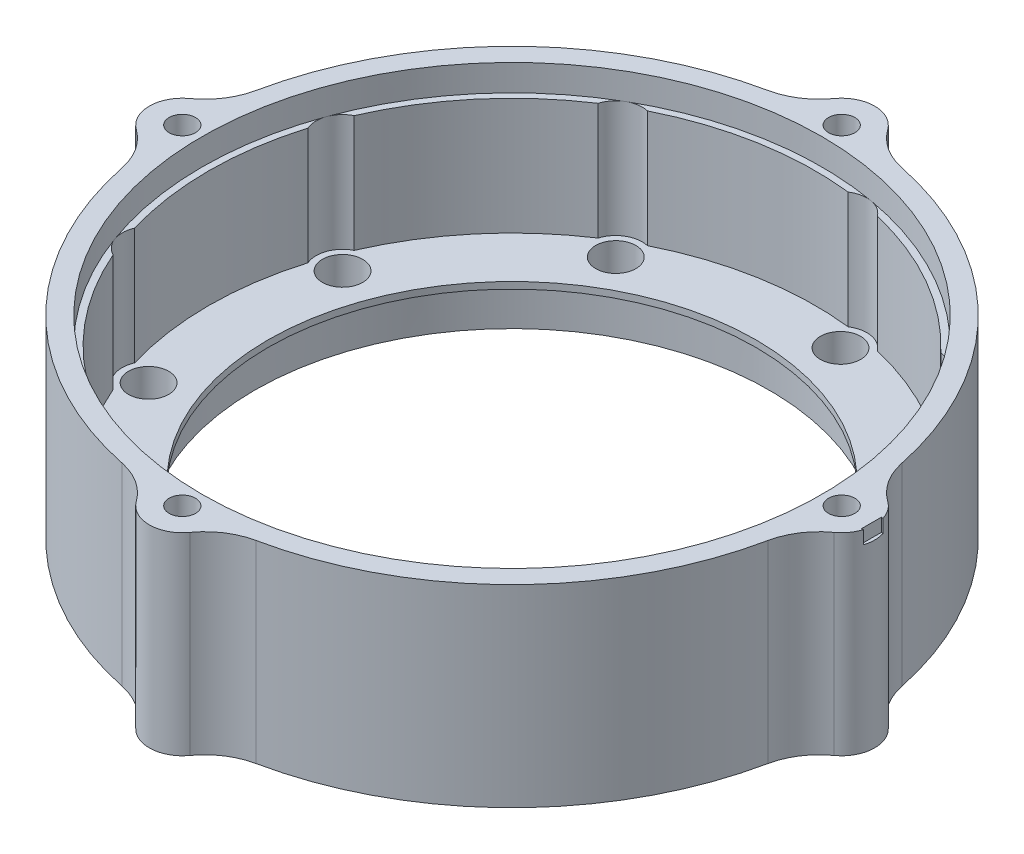
from build123d import *
from build123d.topology import SkipClean

# Parameters (mm, degrees)
SKETCH1_R            = 50
BOSS_EXTRUDE1_DEPTH  = 5
SKETCH2_R            = 3
BOSS_EXTRUDE2_DEPTH  = 30
SKETCH3_R            = 50
BOSS_EXTRUDE3_DEPTH  = 28
SKETCH4_R            = 39
CUT_EXTRUDE1_DEPTH   = 6
SKETCH5_R            = 3
CUT_EXTRUDE2_DEPTH   = 44
SKETCH6_R            = 50
SKETCH6_R_2          = 39
BOSS_EXTRUDE4_DEPTH  = 3
CUT_EXTRUDE3_START   = -4
SKETCH7_R            = 47
SKETCH7_R_2          = 46
CUT_EXTRUDE3_DEPTH   = 4
BOSS_EXTRUDE5_START  = -1
SKETCH8_R            = 39
SKETCH8_R_2          = 37
BOSS_EXTRUDE5_DEPTH  = 1
SKETCH9_R            = 5
SKETCH9_R_2          = 2
BOSS_EXTRUDE6_DEPTH  = 33
SKETCH10_R           = 3.05
CUT_EXTRUDE6_DEPTH   = 2.5
SKETCH11_R           = 47.15
CUT_EXTRUDE7_DEPTH   = 4
SKETCH12_R           = 39
SKETCH12_R_2         = 3.05
BOSS_EXTRUDE7_DEPTH  = 6.3
SKETCH13_R           = 39
SKETCH13_R_2         = 37
BOSS_EXTRUDE8_DEPTH  = 1
SKETCH14_W           = 114
SKETCH14_H           = 3
CUT_EXTRUDE8_DEPTH   = 59.5
SKETCH15_R           = 39
SKETCH15_R_2         = 2
BOSS_EXTRUDE9_DEPTH  = 1
SKETCH16_R           = 3.05
BOSS_EXTRUDE10_DEPTH = 0.7
SKETCH17_W           = 114.080184059
SKETCH17_H           = 0.7
CUT_EXTRUDE9_DEPTH   = 69.85
CUT_EXTRUDE10_START  = -8
CUT_EXTRUDE10_DEPTH  = 8
CUT_EXTRUDE12_START  = -21.3
SKETCH20_R           = 57
SKETCH20_R_2         = 50
CUT_EXTRUDE12_DEPTH  = 21.3
BOSS_EXTRUDE11_START = -21.3
BOSS_EXTRUDE11_DEPTH = 21.3
CUT_EXTRUDE13_START  = -21.3
CUT_EXTRUDE13_DEPTH  = 21.3
FILLET1_R            = 10
SKETCH23_R           = 2
BOSS_EXTRUDE12_DEPTH = 8
CUT_EXTRUDE14_START  = -4
SKETCH24_R           = 47
SKETCH24_R_2         = 46
CUT_EXTRUDE14_DEPTH  = 4
SKETCH25_W           = 1
SKETCH25_H           = 3
CUT_EXTRUDE15_DEPTH  = 2


# Read off the part's stored shape, not the designer's step: Cut-Extrude13
with BuildPart() as part:
    # Sketch1 → Boss-Extrude1 (new body)
    with BuildSketch(Plane(origin=(0, 0, 0), x_dir=(1, 0, 0), z_dir=(0, 1, 0))):
        with Locations(Location((0, 0, 0), (0, 0, 270))):
            Circle(SKETCH1_R)
    extrude(amount=BOSS_EXTRUDE1_DEPTH)

    # Sketch2 → Boss-Extrude2 (add)
    with BuildSketch(Plane(origin=(0, 5, 0), x_dir=(1, 0, 0), z_dir=(0, 1, 0))):
        with Locations(Location((43, 0, 0), (0, 0, 270))):
            Circle(SKETCH2_R)
        with Locations(Location((32.939911054, -27.639867217, 0), (0, 0, 270))):
            Circle(SKETCH2_R)
        with Locations(Location((7.46687164, -42.34673338, 0), (0, 0, 270))):
            Circle(SKETCH2_R)
        with Locations(Location((-21.5, -37.239092363, 0), (0, 0, 270))):
            Circle(SKETCH2_R)
        with Locations(Location((-40.406782694, -14.706866163, 0), (0, 0, 270))):
            Circle(SKETCH2_R)
        with Locations(Location((-40.406782694, 14.706866163, 0), (0, 0, 270))):
            Circle(SKETCH2_R)
        with Locations(Location((-21.5, 37.239092363, 0), (0, 0, 270))):
            Circle(SKETCH2_R)
        with Locations(Location((7.46687164, 42.34673338, 0), (0, 0, 270))):
            Circle(SKETCH2_R)
        with Locations(Location((32.939911054, 27.639867217, 0), (0, 0, 270))):
            Circle(SKETCH2_R)
    extrude(amount=BOSS_EXTRUDE2_DEPTH)

    # Sketch3 → Boss-Extrude3 (add)
    with BuildSketch(Plane(origin=(0, 5, 0), x_dir=(1, 0, 0), z_dir=(0, 1, 0))):
        with Locations(Location((0, 0, 0), (0, 0, 270))):
            Circle(SKETCH3_R)
        with BuildLine():
            ThreePointArc((45.918604651, 2.735278211), (43.225860556, 15.732926593), (36.933894872, 27.42056545))
            ThreePointArc((36.933894872, 27.42056545), (36.004088827, 30.211017655), (33.417488986, 31.611254798))
            ThreePointArc((33.417488986, 31.611254798), (23, 39.837168574), (10.667405207, 44.746021791))
            ThreePointArc((10.667405207, 44.746021791), (8.16146435, 46.285964392), (5.27995883, 45.695973945))
            ThreePointArc((5.27995883, 45.695973945), (-7.987816173, 45.301156639), (-20.590481909, 41.13431724))
            ThreePointArc((-20.590481909, 41.13431724), (-23.5, 40.703193978), (-25.328122743, 38.399039029))
            ThreePointArc((-25.328122743, 38.399039029), (-35.238044383, 29.568230046), (-42.213853702, 18.275408495))
            ThreePointArc((-42.213853702, 18.275408495), (-44.165553177, 16.074946736), (-44.084894193, 13.134766994))
            ThreePointArc((-44.084894193, 13.134766994), (-46, 0), (-44.084894193, -13.134766994))
            ThreePointArc((-44.084894193, -13.134766994), (-44.165553177, -16.074946736), (-42.213853702, -18.275408495))
            ThreePointArc((-42.213853702, -18.275408495), (-35.238044383, -29.568230046), (-25.328122743, -38.399039029))
            ThreePointArc((-25.328122743, -38.399039029), (-23.5, -40.703193978), (-20.590481909, -41.13431724))
            ThreePointArc((-20.590481909, -41.13431724), (-7.987816173, -45.301156639), (5.27995883, -45.695973945))
            ThreePointArc((5.27995883, -45.695973945), (8.16146435, -46.285964392), (10.667405207, -44.746021791))
            ThreePointArc((10.667405207, -44.746021791), (23, -39.837168574), (33.417488986, -31.611254798))
            ThreePointArc((33.417488986, -31.611254798), (36.004088827, -30.211017655), (36.933894872, -27.42056545))
            ThreePointArc((36.933894872, -27.42056545), (43.225860556, -15.732926593), (45.918604651, -2.735278211))
            ThreePointArc((45.918604651, -2.735278211), (47, 0), (45.918604651, 2.735278211))
        make_face(mode=Mode.SUBTRACT)
    extrude(amount=BOSS_EXTRUDE3_DEPTH)

    # Sketch4 → Cut-Extrude1 (cut)
    with BuildSketch(Plane(origin=(0, 5, 0), x_dir=(1, 0, 0), z_dir=(0, 1, 0))):
        with Locations(Location((0, 0, 0), (0, 0, 270))):
            Circle(SKETCH4_R)
    extrude(amount=-CUT_EXTRUDE1_DEPTH, mode=Mode.SUBTRACT)

    # Sketch5 → Cut-Extrude2 (cut, symmetric)
    with BuildSketch(Plane(origin=(0, 5, 0), x_dir=(1, 0, 0), z_dir=(0, 1, 0))):
        with Locations(Location((43, 0, 0), (0, 0, 270))):
            Circle(SKETCH5_R)
        with Locations(Location((32.939911054, -27.639867217, 0), (0, 0, 270))):
            Circle(SKETCH5_R)
        with Locations(Location((7.46687164, -42.34673338, 0), (0, 0, 270))):
            Circle(SKETCH5_R)
        with Locations(Location((-21.5, -37.239092363, 0), (0, 0, 270))):
            Circle(SKETCH5_R)
        with Locations(Location((-40.406782694, -14.706866163, 0), (0, 0, 270))):
            Circle(SKETCH5_R)
        with Locations(Location((-40.406782694, 14.706866163, 0), (0, 0, 270))):
            Circle(SKETCH5_R)
        with Locations(Location((-21.5, 37.239092363, 0), (0, 0, 270))):
            Circle(SKETCH5_R)
        with Locations(Location((7.46687164, 42.34673338, 0), (0, 0, 270))):
            Circle(SKETCH5_R)
        with Locations(Location((32.939911054, 27.639867217, 0), (0, 0, 270))):
            Circle(SKETCH5_R)
    extrude(amount=CUT_EXTRUDE2_DEPTH, both=True, mode=Mode.SUBTRACT)

    # Sketch6 → Boss-Extrude4 (add)
    with BuildSketch(Plane.XZ):
        with Locations(Location((0, 0, 0), (0, 0, 90))):
            Circle(SKETCH6_R)
        with Locations(Location((0, 0, 0), (0, 0, 90))):
            Circle(SKETCH6_R_2, mode=Mode.SUBTRACT)
    extrude(amount=-BOSS_EXTRUDE4_DEPTH)

    # Sketch7 → Cut-Extrude3 (cut)
    with BuildSketch(Plane(origin=(0, 33, 0), x_dir=(1, 0, 0), z_dir=(0, 1, 0)).offset(CUT_EXTRUDE3_START)):
        with Locations(Location((0, 0, 0), (0, 0, 270))):
            Circle(SKETCH7_R)
        Circle(SKETCH7_R_2, mode=Mode.SUBTRACT)
    extrude(amount=CUT_EXTRUDE3_DEPTH, mode=Mode.SUBTRACT)

    # Sketch8 → Boss-Extrude5 (add)
    with BuildSketch(Plane.XZ.offset(BOSS_EXTRUDE5_START)):
        with Locations(Location((0, 0, 0), (0, 0, 90))):
            Circle(SKETCH8_R)
        with Locations(Location((0, 0, 0), (0, 0, 270))):
            Circle(SKETCH8_R_2, mode=Mode.SUBTRACT)
    extrude(amount=BOSS_EXTRUDE5_DEPTH)

    # Sketch9 → Boss-Extrude6 (add)
    # profile 1 of 4: a face of its own
    with BuildSketch(Plane(origin=(0, 33, 0), x_dir=(1, 0, 0), z_dir=(0, 1, 0))):
        with Locations((52, 0)):
            Circle(SKETCH9_R)
        with Locations(Location((52, 0, 0), (0, 0, 270))):
            Circle(SKETCH9_R_2, mode=Mode.SUBTRACT)
    # profile 2 of 4: a face of its own
    with BuildSketch(Plane(origin=(0, 33, 0), x_dir=(1, 0, 0), z_dir=(0, 1, 0))):
        with Locations((-52, 0)):
            Circle(SKETCH9_R)
        with Locations(Location((-52, 0, 0), (0, 0, 270))):
            Circle(SKETCH9_R_2, mode=Mode.SUBTRACT)
    # profile 3 of 4: a face of its own
    with BuildSketch(Plane(origin=(0, 33, 0), x_dir=(1, 0, 0), z_dir=(0, 1, 0))):
        with Locations((0, 52)):
            Circle(SKETCH9_R)
        with Locations(Location((0, 52, 0), (0, 0, 270))):
            Circle(SKETCH9_R_2, mode=Mode.SUBTRACT)
    # profile 4 of 4: a face of its own
    with BuildSketch(Plane(origin=(0, 33, 0), x_dir=(1, 0, 0), z_dir=(0, 1, 0))):
        with Locations((0, -52)):
            Circle(SKETCH9_R)
        with Locations(Location((0, -52, 0), (0, 0, 270))):
            Circle(SKETCH9_R_2, mode=Mode.SUBTRACT)
    extrude(amount=-BOSS_EXTRUDE6_DEPTH)

    # Sketch10 → Cut-Extrude6 (cut)
    with BuildSketch(Plane(origin=(0, 5, 0), x_dir=(1, 0, 0), z_dir=(0, 1, 0))):
        with Locations(Location((32.939911054, -27.639867217, 0), (0, 0, 270))):
            Circle(SKETCH10_R)
        with Locations(Location((43, 0, 0), (0, 0, 270))):
            Circle(SKETCH10_R)
        with Locations(Location((7.46687164, -42.34673338, 0), (0, 0, 270))):
            Circle(SKETCH10_R)
        with Locations(Location((-21.5, -37.239092363, 0), (0, 0, 270))):
            Circle(SKETCH10_R)
        with Locations(Location((-40.406782694, -14.706866163, 0), (0, 0, 270))):
            Circle(SKETCH10_R)
        with Locations(Location((-40.406782694, 14.706866163, 0), (0, 0, 270))):
            Circle(SKETCH10_R)
        with Locations(Location((-21.5, 37.239092363, 0), (0, 0, 270))):
            Circle(SKETCH10_R)
        with Locations(Location((7.46687164, 42.34673338, 0), (0, 0, 270))):
            Circle(SKETCH10_R)
        with Locations(Location((32.939911054, 27.639867217, 0), (0, 0, 270))):
            Circle(SKETCH10_R)
    extrude(amount=-CUT_EXTRUDE6_DEPTH, mode=Mode.SUBTRACT)

    # Sketch11 → Cut-Extrude7 (cut)
    with BuildSketch(Plane(origin=(0, 33, 0), x_dir=(1, 0, 0), z_dir=(0, 1, 0))):
        with Locations(Location((0, 0, 0), (0, 0, 270))):
            Circle(SKETCH11_R)
    extrude(amount=-CUT_EXTRUDE7_DEPTH, mode=Mode.SUBTRACT)

    # Sketch12 → Boss-Extrude7 (add)
    with BuildSketch(Plane(origin=(0, 5, 0), x_dir=(1, 0, 0), z_dir=(0, 1, 0))):
        with BuildLine():
            ThreePointArc((36.933894872, -27.42056545), (43.225860556, -15.732926593), (45.918604651, -2.735278211))
            ThreePointArc((45.918604651, -2.735278211), (47, 0), (45.918604651, 2.735278211))
            ThreePointArc((45.918604651, 2.735278211), (43.225860556, 15.732926593), (36.933894872, 27.42056545))
            ThreePointArc((36.933894872, 27.42056545), (36.004088827, 30.211017655), (33.417488986, 31.611254798))
            ThreePointArc((33.417488986, 31.611254798), (23, 39.837168574), (10.667405207, 44.746021791))
            ThreePointArc((10.667405207, 44.746021791), (8.16146435, 46.285964392), (5.27995883, 45.695973945))
            ThreePointArc((5.27995883, 45.695973945), (-7.987816173, 45.301156639), (-20.590481909, 41.13431724))
            ThreePointArc((-20.590481909, 41.13431724), (-23.5, 40.703193978), (-25.328122743, 38.399039029))
            ThreePointArc((-25.328122743, 38.399039029), (-35.238044383, 29.568230046), (-42.213853702, 18.275408495))
            ThreePointArc((-42.213853702, 18.275408495), (-44.165553177, 16.074946736), (-44.084894193, 13.134766994))
            ThreePointArc((-44.084894193, 13.134766994), (-46, 0), (-44.084894193, -13.134766994))
            ThreePointArc((-44.084894193, -13.134766994), (-44.165553177, -16.074946736), (-42.213853702, -18.275408495))
            ThreePointArc((-42.213853702, -18.275408495), (-35.238044383, -29.568230046), (-25.328122743, -38.399039029))
            ThreePointArc((-25.328122743, -38.399039029), (-23.5, -40.703193978), (-20.590481909, -41.13431724))
            ThreePointArc((-20.590481909, -41.13431724), (-7.987816173, -45.301156639), (5.27995883, -45.695973945))
            ThreePointArc((5.27995883, -45.695973945), (8.16146435, -46.285964392), (10.667405207, -44.746021791))
            ThreePointArc((10.667405207, -44.746021791), (23, -39.837168574), (33.417488986, -31.611254798))
            ThreePointArc((33.417488986, -31.611254798), (36.004088827, -30.211017655), (36.933894872, -27.42056545))
        make_face()
        with Locations(Location((0, 0, 0), (0, 0, 270))):
            Circle(SKETCH12_R, mode=Mode.SUBTRACT)
        with Locations(Location((32.939911054, -27.639867217, 0), (0, 0, 270))):
            Circle(SKETCH12_R_2, mode=Mode.SUBTRACT)
        with Locations(Location((43, 0, 0), (0, 0, 270))):
            Circle(SKETCH12_R_2, mode=Mode.SUBTRACT)
        with Locations(Location((7.46687164, -42.34673338, 0), (0, 0, 270))):
            Circle(SKETCH12_R_2, mode=Mode.SUBTRACT)
        with Locations(Location((-21.5, -37.239092363, 0), (0, 0, 270))):
            Circle(SKETCH12_R_2, mode=Mode.SUBTRACT)
        with Locations(Location((-40.406782694, -14.706866163, 0), (0, 0, 270))):
            Circle(SKETCH12_R_2, mode=Mode.SUBTRACT)
        with Locations(Location((-40.406782694, 14.706866163, 0), (0, 0, 270))):
            Circle(SKETCH12_R_2, mode=Mode.SUBTRACT)
        with Locations(Location((-21.5, 37.239092363, 0), (0, 0, 270))):
            Circle(SKETCH12_R_2, mode=Mode.SUBTRACT)
        with Locations(Location((7.46687164, 42.34673338, 0), (0, 0, 270))):
            Circle(SKETCH12_R_2, mode=Mode.SUBTRACT)
        with Locations(Location((32.939911054, 27.639867217, 0), (0, 0, 270))):
            Circle(SKETCH12_R_2, mode=Mode.SUBTRACT)
    extrude(amount=BOSS_EXTRUDE7_DEPTH)

    # Sketch13 → Boss-Extrude8 (add)
    with BuildSketch(Plane(origin=(0, 11.3, 0), x_dir=(1, 0, 0), z_dir=(0, 1, 0))):
        with Locations(Location((0, 0, 0), (0, 0, 270))):
            Circle(SKETCH13_R)
        with Locations(Location((0, 0, 0), (0, 0, 90))):
            Circle(SKETCH13_R_2, mode=Mode.SUBTRACT)
    extrude(amount=-BOSS_EXTRUDE8_DEPTH)

    # Sketch14 → Cut-Extrude8 (cut, symmetric)
    with BuildSketch(Plane.XY):
        with Locations((0, 1.5)):
            Rectangle(SKETCH14_W, SKETCH14_H)
    extrude(amount=CUT_EXTRUDE8_DEPTH, both=True, mode=Mode.SUBTRACT)

    # Sketch15 → Boss-Extrude9 (add)
    with BuildSketch(Plane.XZ.offset(-3)):
        with BuildLine():
            ThreePointArc((4.489046086, -49.798076923), (35.355339059, -35.355339059), (49.798076923, -4.489046086))
            ThreePointArc((49.798076923, -4.489046086), (57, 0), (49.798076923, 4.489046086))
            ThreePointArc((49.798076923, 4.489046086), (35.355339059, 35.355339059), (4.489046086, 49.798076923))
            ThreePointArc((4.489046086, 49.798076923), (0, 57), (-4.489046086, 49.798076923))
            ThreePointArc((-4.489046086, 49.798076923), (-35.355339059, 35.355339059), (-49.798076923, 4.489046086))
            ThreePointArc((-49.798076923, 4.489046086), (-57, 0), (-49.798076923, -4.489046086))
            ThreePointArc((-49.798076923, -4.489046086), (-35.355339059, -35.355339059), (-4.489046086, -49.798076923))
            ThreePointArc((-4.489046086, -49.798076923), (0, -57), (4.489046086, -49.798076923))
        make_face()
        with Locations(Location((0, 0, 0), (0, 0, 90))):
            Circle(SKETCH15_R, mode=Mode.SUBTRACT)
        with Locations(Location((0, -52, 0), (0, 0, 90))):
            Circle(SKETCH15_R_2, mode=Mode.SUBTRACT)
        with Locations(Location((52, 0, 0), (0, 0, 90))):
            Circle(SKETCH15_R_2, mode=Mode.SUBTRACT)
        with Locations(Location((-52, 0, 0), (0, 0, 180))):
            Circle(SKETCH15_R_2, mode=Mode.SUBTRACT)
        with Locations(Location((0, 52, 0), (0, 0, 180))):
            Circle(SKETCH15_R_2, mode=Mode.SUBTRACT)
    extrude(amount=-BOSS_EXTRUDE9_DEPTH)

    # Sketch16 → Boss-Extrude10 (add)
    with BuildSketch(Plane(origin=(0, 4, 0), x_dir=(1, 0, 0), z_dir=(0, 1, 0))):
        with Locations(Location((32.939911054, -27.639867217, 0), (0, 0, 270))):
            Circle(SKETCH16_R)
        with Locations(Location((43, 0, 0), (0, 0, 270))):
            Circle(SKETCH16_R)
        with Locations(Location((7.46687164, -42.34673338, 0), (0, 0, 270))):
            Circle(SKETCH16_R)
        with Locations(Location((-21.5, -37.239092363, 0), (0, 0, 270))):
            Circle(SKETCH16_R)
        with Locations(Location((-40.406782694, -14.706866163, 0), (0, 0, 270))):
            Circle(SKETCH16_R)
        with Locations(Location((-40.406782694, 14.706866163, 0), (0, 0, 270))):
            Circle(SKETCH16_R)
        with Locations(Location((-21.5, 37.239092363, 0), (0, 0, 270))):
            Circle(SKETCH16_R)
        with Locations(Location((7.46687164, 42.34673338, 0), (0, 0, 270))):
            Circle(SKETCH16_R)
        with Locations(Location((32.939911054, 27.639867217, 0), (0, 0, 270))):
            Circle(SKETCH16_R)
    extrude(amount=BOSS_EXTRUDE10_DEPTH)

    # Sketch17 → Cut-Extrude9 (cut, symmetric)
    with BuildSketch(Plane.XY):
        with Locations((-0.04009203, 3.35)):
            Rectangle(SKETCH17_W, SKETCH17_H)
    extrude(amount=CUT_EXTRUDE9_DEPTH, both=True, mode=Mode.SUBTRACT)

    # Sketch18 → Cut-Extrude10 (cut)
    with BuildSketch(Plane(origin=(0, 33, 0), x_dir=(1, 0, 0), z_dir=(0, 1, 0)).offset(CUT_EXTRUDE10_START)):
        with BuildLine():
            ThreePointArc((4.489046086, -49.798076923), (35.355339059, -35.355339059), (49.798076923, -4.489046086))
            ThreePointArc((49.798076923, -4.489046086), (57, 0), (49.798076923, 4.489046086))
            ThreePointArc((49.798076923, 4.489046086), (35.355339059, 35.355339059), (4.489046086, 49.798076923))
            ThreePointArc((4.489046086, 49.798076923), (0, 57), (-4.489046086, 49.798076923))
            ThreePointArc((-4.489046086, 49.798076923), (-35.355339059, 35.355339059), (-49.798076923, 4.489046086))
            ThreePointArc((-49.798076923, 4.489046086), (-57, 0), (-49.798076923, -4.489046086))
            ThreePointArc((-49.798076923, -4.489046086), (-35.355339059, -35.355339059), (-4.489046086, -49.798076923))
            ThreePointArc((-4.489046086, -49.798076923), (0, -57), (4.489046086, -49.798076923))
        make_face()
    extrude(amount=CUT_EXTRUDE10_DEPTH, mode=Mode.SUBTRACT)

    # Sketch20 → Cut-Extrude12 (cut)
    with BuildSketch(Plane(origin=(0, 25, 0), x_dir=(1, 0, 0), z_dir=(0, 1, 0)).offset(CUT_EXTRUDE12_START)):
        Circle(SKETCH20_R)
        with Locations(Location((0, 0, 0), (0, 0, 180))):
            Circle(SKETCH20_R_2, mode=Mode.SUBTRACT)
    extrude(amount=CUT_EXTRUDE12_DEPTH, mode=Mode.SUBTRACT)

    # Sketch21 → Boss-Extrude11 (add)
    with BuildSketch(Plane(origin=(0, 25, 0), x_dir=(1, 0, 0), z_dir=(0, 1, 0)).offset(BOSS_EXTRUDE11_START)):
        with BuildLine():
            ThreePointArc((49.96, 1.99959996), (51.4, 1.428285686), (52, 0))
            ThreePointArc((52, 0), (51.4, -1.428285686), (49.96, -1.99959996))
            ThreePointArc((49.96, -1.99959996), (49.877472397, -3.498249168), (49.75, -4.993746089))
            ThreePointArc((49.75, -4.993746089), (55, 0), (49.75, 4.993746089))
            ThreePointArc((49.75, 4.993746089), (49.877472397, 3.498249168), (49.96, 1.99959996))
        make_face()
        with BuildLine():
            ThreePointArc((-4.992800781, -49.750094878), (0.001100002, -54.998999999), (4.994790821, -49.749895122))
            ThreePointArc((4.994790821, -49.749895122), (3.499281509, -49.877399982), (2.000618918, -49.959959207))
            ThreePointArc((2.000618918, -49.959959207), (2.000904727, -49.979478673), (2.001, -49.999))
            ThreePointArc((2.001, -49.999), (-0.018481328, -51.998905117), (-1.998620478, -49.960039193))
            ThreePointArc((-1.998620478, -49.960039193), (-3.497286371, -49.877539916), (-4.992800781, -49.750094878))
        make_face()
        with BuildLine():
            ThreePointArc((-49.95999844, 1.999638938), (-49.877467544, 3.498318366), (-49.74999004, 4.993845318))
            ThreePointArc((-49.74999004, 4.993845318), (-54.998, 0), (-49.74999004, -4.993845318))
            ThreePointArc((-49.74999004, -4.993845318), (-49.877467544, -3.498318366), (-49.95999844, -1.999638938))
            ThreePointArc((-49.95999844, -1.999638938), (-51.998, 0), (-49.95999844, 1.999638938))
        make_face()
        with BuildLine():
            ThreePointArc((2.000618918, 49.959959207), (3.499281509, 49.877399982), (4.994790821, 49.749895122))
            ThreePointArc((4.994790821, 49.749895122), (0.001100002, 54.998999999), (-4.992800781, 49.750094878))
            ThreePointArc((-4.992800781, 49.750094878), (-3.497286371, 49.877539916), (-1.998620478, 49.960039193))
            ThreePointArc((-1.998620478, 49.960039193), (-0.018481328, 51.998905117), (2.001, 49.999))
            ThreePointArc((2.001, 49.999), (2.000904727, 49.979478673), (2.000618918, 49.959959207))
        make_face()
    extrude(amount=BOSS_EXTRUDE11_DEPTH)

    # Cut-Extrude13 outline → Cut-Extrude13 (cut)
    with SkipClean():  # the faces are left unmerged after this step: merging them gives an invalid solid
        with BuildSketch(Plane(origin=(0, 25, 0), x_dir=(1, 0, 0), z_dir=(0, 1, 0)).offset(CUT_EXTRUDE13_START)):
            with BuildLine():
                ThreePointArc((49.96, -1.99959996), (50, 0), (49.96, 1.99959996))
                ThreePointArc((49.96, 1.99959996), (48, 0), (49.96, -1.99959996))
            make_face()
            with BuildLine():
                ThreePointArc((-1.998620478, -49.960039193), (0.00100002, -49.99999999), (2.000618918, -49.959959207))
                ThreePointArc((2.000618918, -49.959959207), (0.000959999, -47.999), (-1.998620478, -49.960039193))
            make_face()
            with BuildLine():
                ThreePointArc((-49.95999844, -1.999638938), (-47.998, 0), (-49.95999844, 1.999638938))
                ThreePointArc((-49.95999844, 1.999638938), (-50, 0), (-49.95999844, -1.999638938))
            make_face()
            with BuildLine():
                ThreePointArc((2.000618918, 49.959959207), (0.00100002, 49.99999999), (-1.998620478, 49.960039193))
                ThreePointArc((-1.998620478, 49.960039193), (0.000959999, 47.999), (2.000618918, 49.959959207))
            make_face()
        extrude(amount=CUT_EXTRUDE13_DEPTH, mode=Mode.SUBTRACT)

    # Fillet1
    fillet1_edges = [part.edges().sort_by_distance(p)[0] for p in [
        (49.75, 14.35, 4.993746089),
        (49.75, 14.35, -4.993746089),
        (-4.992800781, 14.35, 49.750094878),
        (4.994790821, 14.35, 49.749895122),
        (-49.74999004, 14.35, -4.993845318),
        (-49.74999004, 14.35, 4.993845318),
        (4.994790821, 14.35, -49.749895122),
        (-4.992800781, 14.35, -49.750094878),
    ]]
    fillet(fillet1_edges, radius=FILLET1_R)

    # Sketch23 → Boss-Extrude12 (add)
    with SkipClean():  # the faces are left unmerged after this step: merging them gives an invalid solid
        with BuildSketch(Plane(origin=(0, 25, 0), x_dir=(1, 0, 0), z_dir=(0, 1, 0))):
            with BuildLine():
                ThreePointArc((-48.958625045, -10.151504012), (-35.355239503, -35.355438615), (-10.151228289, -48.958682215))
                ThreePointArc((-10.151228289, -48.958682215), (-6.733482579, -50.364752909), (-4.059824649, -52.916139553))
                ThreePointArc((-4.059824649, -52.916139553), (0.001100002, -54.998999999), (4.061941334, -52.915977114))
                ThreePointArc((4.061941334, -52.915977114), (6.735497204, -50.364483524), (10.153186668, -48.958276118))
                ThreePointArc((10.153186668, -48.958276118), (35.355438677, -35.355239441), (48.958333333, -10.152910776))
                ThreePointArc((48.958333333, -10.152910776), (50.364745084, -6.734869252), (52.916666667, -4.06116431))
                ThreePointArc((52.916666667, -4.06116431), (55, 0), (52.916666667, 4.06116431))
                ThreePointArc((52.916666667, 4.06116431), (50.364745084, 6.734869252), (48.958333333, 10.152910776))
                ThreePointArc((48.958333333, 10.152910776), (35.355438677, 35.355239441), (10.153186668, 48.958276118))
                ThreePointArc((10.153186668, 48.958276118), (6.735497204, 50.364483524), (4.061941334, 52.915977114))
                ThreePointArc((4.061941334, 52.915977114), (0.001100002, 54.998999999), (-4.059824649, 52.916139553))
                ThreePointArc((-4.059824649, 52.916139553), (-6.733482579, 50.364752909), (-10.151228289, 48.958682215))
                ThreePointArc((-10.151228289, 48.958682215), (-35.355239503, 35.355438615), (-48.958625045, 10.151504012))
                ThreePointArc((-48.958625045, 10.151504012), (-50.364491386, 6.734110404), (-52.915450018, 4.060601605))
                ThreePointArc((-52.915450018, 4.060601605), (-54.998, 0), (-52.915450018, -4.060601605))
                ThreePointArc((-52.915450018, -4.060601605), (-50.364491386, -6.734110404), (-48.958625045, -10.151504012))
            make_face()
            with Locations(Location((0, -50, 0), (0, 0, 134.979742882))):
                Circle(SKETCH23_R, mode=Mode.SUBTRACT)
            with Locations(Location((50, 0, 0), (0, 0, 270))):
                Circle(SKETCH23_R, mode=Mode.SUBTRACT)
            with Locations(Location((-50, 0, 0), (0, 0, 89.971352109))):
                Circle(SKETCH23_R, mode=Mode.SUBTRACT)
            with Locations(Location((0, 50, 0), (0, 0, 44.979742883))):
                Circle(SKETCH23_R, mode=Mode.SUBTRACT)
            with BuildLine():
                ThreePointArc((-42.213853702, 18.275408495), (-44.165553177, 16.074946736), (-44.084894193, 13.134766994))
                ThreePointArc((-44.084894193, 13.134766994), (-46, 0), (-44.084894193, -13.134766994))
                ThreePointArc((-44.084894193, -13.134766994), (-44.165553177, -16.074946736), (-42.213853702, -18.275408495))
                ThreePointArc((-42.213853702, -18.275408495), (-35.238044383, -29.568230046), (-25.328122743, -38.399039029))
                ThreePointArc((-25.328122743, -38.399039029), (-23.5, -40.703193978), (-20.590481909, -41.13431724))
                ThreePointArc((-20.590481909, -41.13431724), (-7.987816173, -45.301156639), (5.27995883, -45.695973945))
                ThreePointArc((5.27995883, -45.695973945), (8.16146435, -46.285964392), (10.667405207, -44.746021791))
                ThreePointArc((10.667405207, -44.746021791), (23, -39.837168574), (33.417488986, -31.611254798))
                ThreePointArc((33.417488986, -31.611254798), (36.004088827, -30.211017655), (36.933894872, -27.42056545))
                ThreePointArc((36.933894872, -27.42056545), (43.225860556, -15.732926593), (45.918604651, -2.735278211))
                ThreePointArc((45.918604651, -2.735278211), (47, 0), (45.918604651, 2.735278211))
                ThreePointArc((45.918604651, 2.735278211), (43.225860556, 15.732926593), (36.933894872, 27.42056545))
                ThreePointArc((36.933894872, 27.42056545), (36.004088827, 30.211017655), (33.417488986, 31.611254798))
                ThreePointArc((33.417488986, 31.611254798), (23, 39.837168574), (10.667405207, 44.746021791))
                ThreePointArc((10.667405207, 44.746021791), (8.16146435, 46.285964392), (5.27995883, 45.695973945))
                ThreePointArc((5.27995883, 45.695973945), (-7.987816173, 45.301156639), (-20.590481909, 41.13431724))
                ThreePointArc((-20.590481909, 41.13431724), (-23.5, 40.703193978), (-25.328122743, 38.399039029))
                ThreePointArc((-25.328122743, 38.399039029), (-35.238044383, 29.568230046), (-42.213853702, 18.275408495))
            make_face(mode=Mode.SUBTRACT)
        extrude(amount=BOSS_EXTRUDE12_DEPTH)

    # Sketch24 → Cut-Extrude14 (cut)
    with SkipClean():  # the faces are left unmerged after this step: merging them gives an invalid solid
        with BuildSketch(Plane(origin=(0, 33, 0), x_dir=(1, 0, 0), z_dir=(0, 1, 0)).offset(CUT_EXTRUDE14_START)):
            with Locations(Location((0, 0, 0), (0, 0, 270))):
                Circle(SKETCH24_R)
            Circle(SKETCH24_R_2, mode=Mode.SUBTRACT)
        extrude(amount=CUT_EXTRUDE14_DEPTH, mode=Mode.SUBTRACT)

    # Sketch25 → Cut-Extrude15 (cut)
    with SkipClean():  # the faces are left unmerged after this step: merging them gives an invalid solid
        with BuildSketch(Plane(origin=(0, 33, 0), x_dir=(1, 0, 0), z_dir=(0, 1, 0))):
            with Locations((55, 0)):
                Rectangle(SKETCH25_W, SKETCH25_H)
        extrude(amount=-CUT_EXTRUDE15_DEPTH, mode=Mode.SUBTRACT)


solid = part.part
